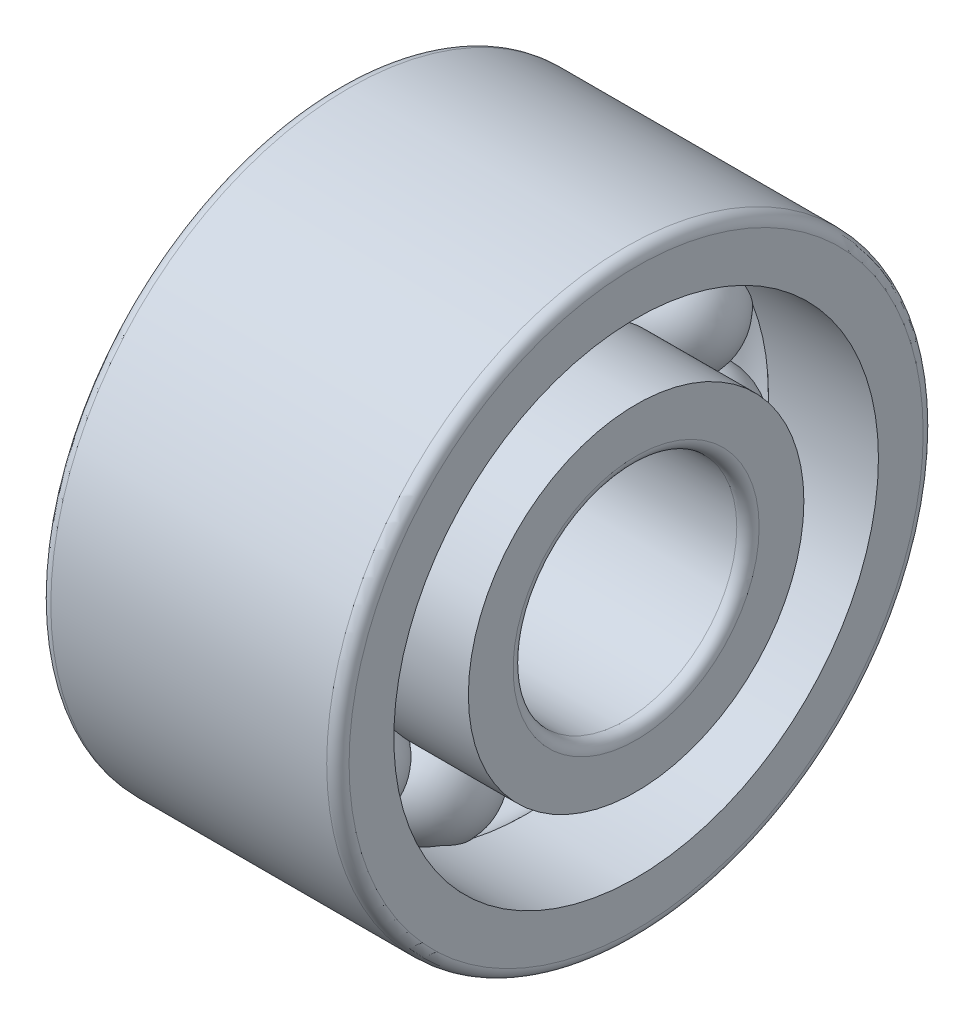
from build123d import *

# Parameters (mm, degrees)
CAGSPISKE_W         = 0.15
CAGSPISKE_H         = 0.25
CAGESPINE_ANGLE     = 0.001
BALLSDETAILED_COUNT = 11
BALLSDETAILED_ANGLE = 327.272727273


with BuildPart() as part:
    # CagSpiSke → CageSpine (revolve)
    with BuildSketch(Plane.XY):
        with Locations((0, 2.75)):
            Rectangle(CAGSPISKE_W, CAGSPISKE_H)
    revolve(axis=Axis((-20.6375, 0, 0), (-1, 0, 0)), revolution_arc=CAGESPINE_ANGLE)

    # BalDetSke → BallDetailed (revolve)
    with BuildSketch(Plane.XY):
        with BuildLine():
            Line((-0.75, 2.75), (0.75, 2.75))
            ThreePointArc((0.75, 2.75), (0, 2), (-0.75, 2.75))
        make_face()
    balldetailed = revolve(axis=Axis((-1.905, 2.75, 0), (1, 0, 0)))

    # InnRacSke → InnerRace (revolve)
    with BuildSketch(Plane.XY):
        with BuildLine():
            Line((-0.525, 2.25), (-2, 2.25))
            Line((-2, 2.25), (-2, 1.65))
            ThreePointArc((-2, 1.65), (-1.956066017, 1.543933983), (-1.85, 1.5))
            Line((-1.85, 1.5), (1.85, 1.5))
            ThreePointArc((1.85, 1.5), (1.956066017, 1.543933983), (2, 1.65))
            Line((2, 1.65), (2, 2.25))
            Line((2, 2.25), (0.525, 2.25))
            ThreePointArc((0.525, 2.25), (0, 2.025), (-0.525, 2.25))
        make_face()
    revolve(axis=Axis((-20.6375, 0, 0), (1, 0, 0)))

    # OutRacSke → OuterRace (revolve)
    with BuildSketch(Plane.XY):
        with BuildLine():
            Line((-0.525, 3.25), (-2, 3.25))
            Line((-2, 3.25), (-2, 3.85))
            ThreePointArc((-2, 3.85), (-1.956066017, 3.956066017), (-1.85, 4))
            Line((-1.85, 4), (1.85, 4))
            ThreePointArc((1.85, 4), (1.956066017, 3.956066017), (2, 3.85))
            Line((2, 3.85), (2, 3.25))
            Line((2, 3.25), (0.525, 3.25))
            ThreePointArc((0.525, 3.25), (0, 3.475), (-0.525, 3.25))
        make_face()
    revolve(axis=Axis((-20.6375, 0, 0), (1, 0, 0)))

    # BallsDetailed: BallDetailed ×11 about axis
    ballsdetailed_axis = Axis((-50, 0, 0), (1, 0, 0))
    for i in range(1, BALLSDETAILED_COUNT):
        add(balldetailed.rotate(ballsdetailed_axis, i * BALLSDETAILED_ANGLE / (BALLSDETAILED_COUNT - 1)))


solid = part.part
